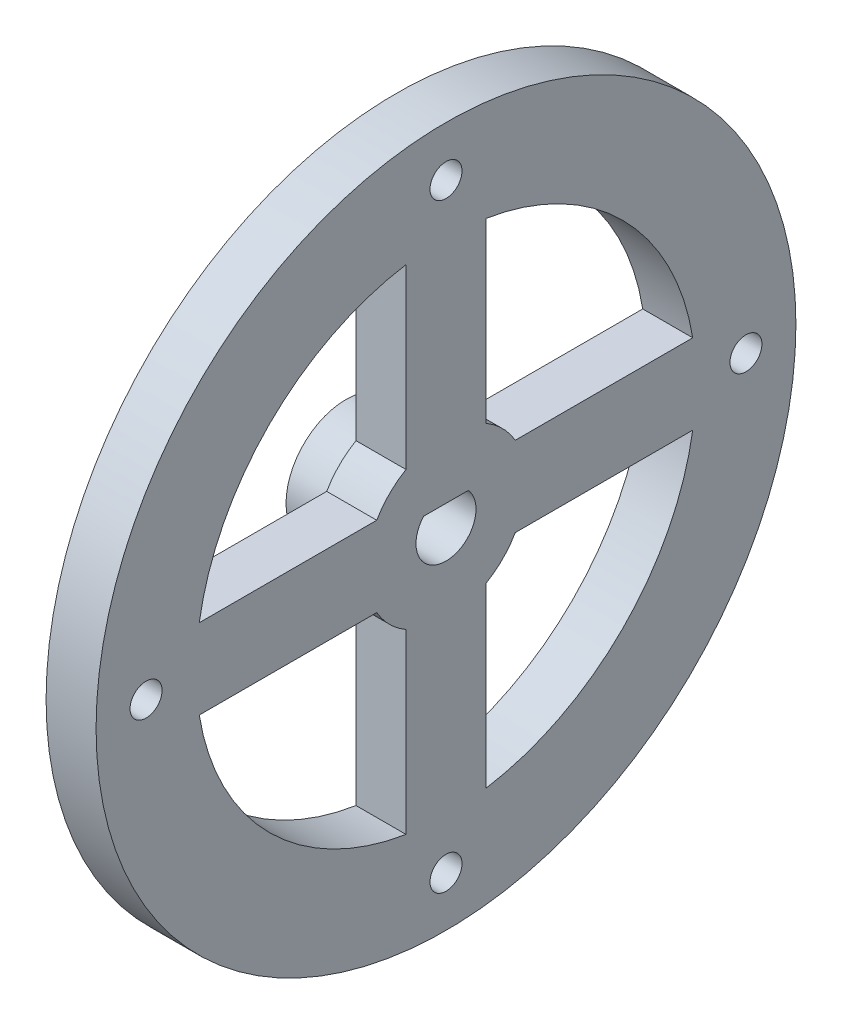
from build123d import *

# Parameters (mm, degrees)
SKETCH1_R           = 35
BOSS_EXTRUDE1_DEPTH = 5
SKETCH2_R           = 1.6
CUT_EXTRUDE1_DEPTH  = 50.749371855
BOSS_EXTRUDE2_START = 5
SKETCH3_R           = 6
BOSS_EXTRUDE2_DEPTH = 5
SKETCH6_R           = 4
CUT_EXTRUDE2_DEPTH  = 2
CUT_EXTRUDE3_DEPTH  = 2.3876


with BuildPart() as part:
    # Sketch1 → Boss-Extrude1 (new body)
    with BuildSketch(Plane(origin=(0, 0, 0), x_dir=(0, 0, -1), z_dir=(1, 0, 0))):
        Circle(SKETCH1_R)
        with BuildLine():
            Line((4, 6.92820323), (4, 24.677925359))
            ThreePointArc((4, 24.677925359), (17.67766953, 17.67766953), (24.677925359, 4))
            Line((24.677925359, 4), (6.92820323, 4))
            ThreePointArc((6.92820323, 4), (5.656854249, 5.656854249), (4, 6.92820323))
        make_face(mode=Mode.SUBTRACT)
        with BuildLine():
            Line((-4, 24.677925359), (-4, 6.92820323))
            ThreePointArc((-4, 6.92820323), (-5.656854249, 5.656854249), (-6.92820323, 4))
            Line((-6.92820323, 4), (-24.677925359, 4))
            ThreePointArc((-24.677925359, 4), (-17.67766953, 17.67766953), (-4, 24.677925359))
        make_face(mode=Mode.SUBTRACT)
        with BuildLine():
            Line((-24.677925359, -4), (-6.92820323, -4))
            ThreePointArc((-6.92820323, -4), (-5.656854249, -5.656854249), (-4, -6.92820323))
            Line((-4, -6.92820323), (-4, -24.677925359))
            ThreePointArc((-4, -24.677925359), (-17.67766953, -17.67766953), (-24.677925359, -4))
        make_face(mode=Mode.SUBTRACT)
        with BuildLine():
            Line((4, -24.677925359), (4, -6.92820323))
            ThreePointArc((4, -6.92820323), (5.656854249, -5.656854249), (6.92820323, -4))
            Line((6.92820323, -4), (24.677925359, -4))
            ThreePointArc((24.677925359, -4), (17.67766953, -17.67766953), (4, -24.677925359))
        make_face(mode=Mode.SUBTRACT)
        with BuildLine():
            Line((2.236067977, 2), (-2.236067977, 2))
            ThreePointArc((-2.236067977, 2), (0, -3), (2.236067977, 2))
        make_face(mode=Mode.SUBTRACT)
    extrude(amount=BOSS_EXTRUDE1_DEPTH)

    # Sketch2 → Cut-Extrude1 (cut, through all)
    with BuildSketch(Plane.ZY):
        with Locations((0, 30)):
            Circle(SKETCH2_R)
        with Locations((30, 0)):
            Circle(SKETCH2_R)
        with Locations((0, -30)):
            Circle(SKETCH2_R)
        with Locations((-30, 0)):
            Circle(SKETCH2_R)
    extrude(amount=-CUT_EXTRUDE1_DEPTH, mode=Mode.SUBTRACT)

    # Sketch3 → Boss-Extrude2 (add)
    with BuildSketch(Plane.ZY.offset(BOSS_EXTRUDE2_START)):
        Circle(SKETCH3_R)
        with BuildLine():
            Line((-2.236067977, 2), (2.236067977, 2))
            ThreePointArc((2.236067977, 2), (0, -3), (-2.236067977, 2))
        make_face(mode=Mode.SUBTRACT)
    extrude(amount=-BOSS_EXTRUDE2_DEPTH)

    # Sketch6 → Cut-Extrude2 (cut)
    with BuildSketch(Plane.ZY):
        with Locations((0, 30)):
            Circle(SKETCH6_R)
        with Locations((30, 0)):
            Circle(SKETCH6_R)
        with Locations((0, -30)):
            Circle(SKETCH6_R)
        with Locations((-30, 0)):
            Circle(SKETCH6_R)
    extrude(amount=-CUT_EXTRUDE2_DEPTH, mode=Mode.SUBTRACT)

    # Sketch7 → Cut-Extrude3 (cut)
    with BuildSketch(Plane.ZY.offset(5)):
        with BuildLine():
            Line((-3.9116, -3.300656457), (-3.9116, 3.300656457))
            ThreePointArc((-3.9116, 3.300656457), (0, 5.1181), (3.9116, 3.300656457))
            Line((3.9116, 3.300656457), (3.9116, -3.300656457))
            ThreePointArc((3.9116, -3.300656457), (0, -5.1181), (-3.9116, -3.300656457))
        make_face()
    extrude(amount=-CUT_EXTRUDE3_DEPTH, mode=Mode.SUBTRACT)


solid = part.part
